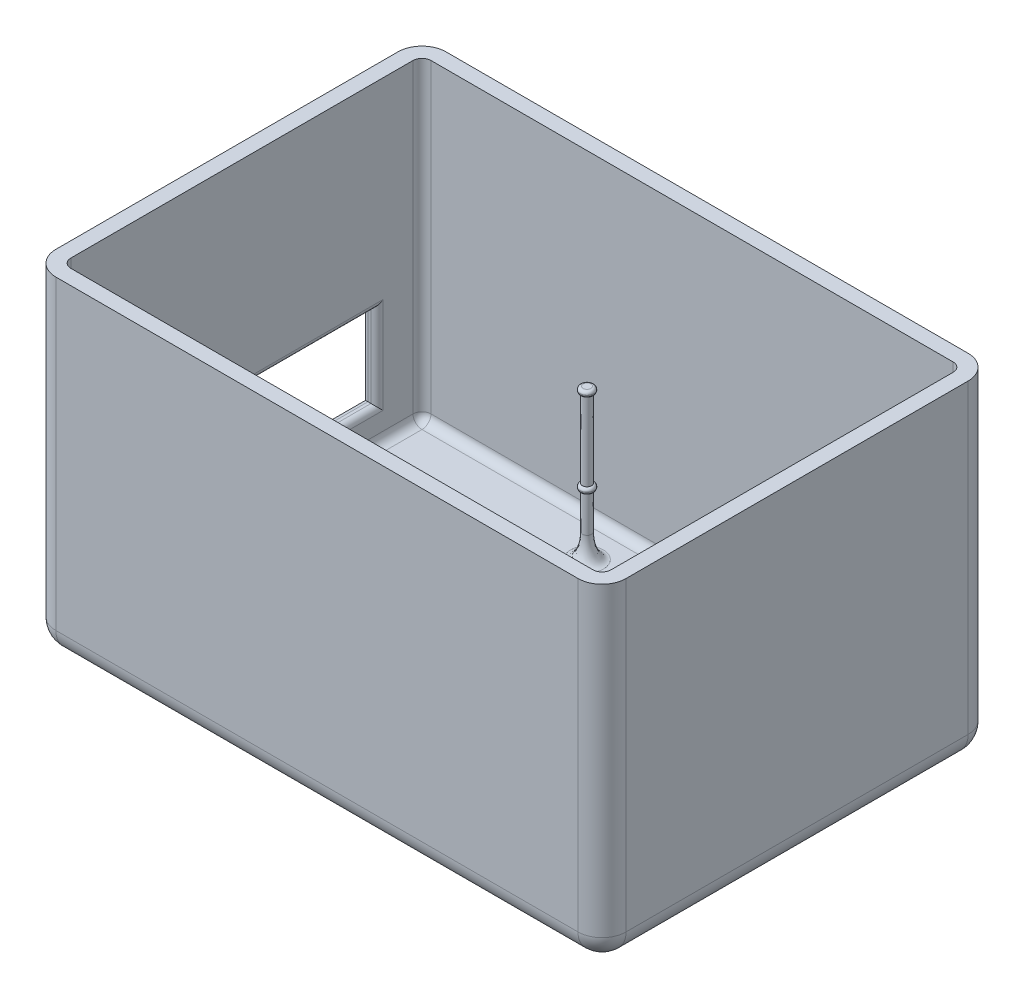
from build123d import *

# Parameters (mm, degrees)
SKETCH2_W           = 95
SKETCH2_H           = 65
BOSS_EXTRUDE1_DEPTH = 55
FILLET2_R           = 4
SHELL1_T            = -2.5
SKETCH10_R          = 0.75
BOSS_EXTRUDE2_DEPTH = 25
FILLET3_SIZE        = 2
FILLET3_SIZE_2      = 4
SKETCH12_R          = 1.15
BOSS_EXTRUDE3_DEPTH = 1
BOSS_EXTRUDE4_START = 1
SKETCH14_R          = 1.15
BOSS_EXTRUDE4_DEPTH = 1
FILLET4_R           = 0.5
SKETCH16_W          = 45
SKETCH16_H          = 14
CUT_EXTRUDE1_DEPTH  = 4
FILLET5_R           = 1


with BuildPart() as part:
    # Sketch2 → Boss-Extrude1 (new body)
    with BuildSketch(Plane(origin=(0, 0, 0), x_dir=(1, 0, 0), z_dir=(0, 1, 0))):
        with Locations((47.5, 32.5)):
            Rectangle(SKETCH2_W, SKETCH2_H)
    extrude(amount=BOSS_EXTRUDE1_DEPTH)

    # Fillet2
    fillet2_edges = [part.edges().sort_by_distance(p)[0] for p in [
        (47.5, 0, -65),
        (95, 0, -32.5),
        (47.5, 0, 0),
        (0, 0, -32.5),
        (0, 27.5, -65),
        (95, 27.5, -65),
        (95, 27.5, 0),
        (0, 27.5, 0),
    ]]
    fillet(fillet2_edges, radius=FILLET2_R)

    # Shell1
    shell1_openings = [part.faces().sort_by_distance(p)[0] for p in [
        (47.5, 55, -32.5),
    ]]
    offset(amount=SHELL1_T, openings=shell1_openings, kind=Kind.INTERSECTION)

    # Sketch10 → Boss-Extrude2 (add)
    with BuildSketch(Plane(origin=(0, 2.5, 0), x_dir=(1, 0, 0), z_dir=(0, 1, 0))):
        with Locations(Location((87.5, 12.5, 0), (0, 0, 90))):
            Circle(SKETCH10_R)
        with Locations(Location((87.5, 40.5, 0), (0, 0, 90))):
            Circle(SKETCH10_R)
        with Locations(Location((36.5, 56, 0), (0, 0, 90))):
            Circle(SKETCH10_R)
    extrude(amount=BOSS_EXTRUDE2_DEPTH)

    # Fillet3
    # an asymmetric fillet: 4, 2 mm, written as the material it adds along each edge
    with BuildSketch(Plane(origin=(87.5, 2.5, -12.5), x_dir=(0, 0, -1), z_dir=(1, 0, 0))) as fillet3_piece_1:
        with BuildLine():
            Bezier((0.75 + FILLET3_SIZE, 0), (0.75, 0), (0.75, FILLET3_SIZE_2), weights=[1, 0.707106781, 1])
            Line((0.75, FILLET3_SIZE_2), (0.75, 0))
            Line((0.75, 0), (0.75 + FILLET3_SIZE, 0))
        make_face()
    revolve(axis=Axis((87.5, 2.5, -12.5), (0, 1, 0)))
    with BuildSketch(Plane(origin=(87.5, 2.5, -40.5), x_dir=(0, 0, -1), z_dir=(1, 0, 0))) as fillet3_piece_2:
        with BuildLine():
            Bezier((0.75 + FILLET3_SIZE, 0), (0.75, 0), (0.75, FILLET3_SIZE_2), weights=[1, 0.707106781, 1])
            Line((0.75, FILLET3_SIZE_2), (0.75, 0))
            Line((0.75, 0), (0.75 + FILLET3_SIZE, 0))
        make_face()
    revolve(axis=Axis((87.5, 2.5, -40.5), (0, 1, 0)))
    with BuildSketch(Plane(origin=(36.5, 2.5, -56), x_dir=(0, 0, -1), z_dir=(1, 0, 0))) as fillet3_piece_3:
        with BuildLine():
            Bezier((0.75 + FILLET3_SIZE, 0), (0.75, 0), (0.75, FILLET3_SIZE_2), weights=[1, 0.707106781, 1])
            Line((0.75, FILLET3_SIZE_2), (0.75, 0))
            Line((0.75, 0), (0.75 + FILLET3_SIZE, 0))
        make_face()
    revolve(axis=Axis((36.5, 2.5, -56), (0, 1, 0)))

    # Sketch12 → Boss-Extrude3 (add)
    with BuildSketch(Plane(origin=(0, 12.5, 0), x_dir=(-1, 0, 0), z_dir=(0, -1, 0))):
        with Locations(Location((-36.5, 56, 0), (0, 0, 180))):
            Circle(SKETCH12_R)
        with Locations(Location((-87.5, 40.5, 0), (0, 0, 180))):
            Circle(SKETCH12_R)
        with Locations(Location((-87.5, 12.5, 0), (0, 0, 180))):
            Circle(SKETCH12_R)
    extrude(amount=-BOSS_EXTRUDE3_DEPTH)

    # Sketch14 → Boss-Extrude4 (add)
    with BuildSketch(Plane(origin=(0, 27.5, 0), x_dir=(-1, 0, 0), z_dir=(0, -1, 0)).offset(BOSS_EXTRUDE4_START)):
        with Locations(Location((-36.5, 56, 0), (0, 0, 180))):
            Circle(SKETCH14_R)
        with Locations(Location((-87.5, 40.5, 0), (0, 0, 180))):
            Circle(SKETCH14_R)
        with Locations(Location((-87.5, 12.5, 0), (0, 0, 180))):
            Circle(SKETCH14_R)
    extrude(amount=-BOSS_EXTRUDE4_DEPTH)

    # Fillet4
    # the kernel refuses this fillet: 0.5 mm, written as the material it takes off along each edge
    with BuildSketch(Plane(origin=(36.5, 13.5, -56), x_dir=(1, 0, 0), z_dir=(0, 0, -1))) as fillet4_piece_1:
        with BuildLine():
            CenterArc((0.65, 0.489897949), FILLET4_R, 281.536959033, 78.463040967)
            Line((0.75, 0), (0.752, -0.009797959))
            ThreePointArc((0.752, -0.009797959), (0.95, -0.01), (1.15, -0.01))
            Line((1.15, -0.01), (1.16, 0))
            Line((1.16, 0), (1.16, 0.489897949))
            Line((1.16, 0.489897949), (1.15, 0.489897949))
        make_face()
    revolve(axis=Axis((36.5, 13.5, -56), (0, -1, 0)), mode=Mode.SUBTRACT)
    with BuildSketch(Plane(origin=(36.5, 12.5, -56), x_dir=(1, 0, 0), z_dir=(0, 0, -1))) as fillet4_piece_2:
        with BuildLine():
            CenterArc((0.65, -0.489897949), FILLET4_R, 360, 78.463040967)
            Line((1.15, -0.489897949), (1.16, -0.489897949))
            Line((1.16, -0.489897949), (1.16, 0))
            Line((1.16, 0), (1.15, 0.01))
            ThreePointArc((1.15, 0.01), (0.95, 0.01), (0.752, 0.009797959))
            Line((0.752, 0.009797959), (0.75, 0))
        make_face()
    revolve(axis=Axis((36.5, 12.5, -56), (0, -1, 0)), mode=Mode.SUBTRACT)
    with BuildSketch(Plane(origin=(87.5, 13.5, -40.5), x_dir=(1, 0, 0), z_dir=(0, 0, -1))) as fillet4_piece_3:
        with BuildLine():
            CenterArc((0.65, 0.489897949), FILLET4_R, 281.536959033, 78.463040967)
            Line((0.75, 0), (0.752, -0.009797959))
            ThreePointArc((0.752, -0.009797959), (0.95, -0.01), (1.15, -0.01))
            Line((1.15, -0.01), (1.16, 0))
            Line((1.16, 0), (1.16, 0.489897949))
            Line((1.16, 0.489897949), (1.15, 0.489897949))
        make_face()
    revolve(axis=Axis((87.5, 13.5, -40.5), (0, -1, 0)), mode=Mode.SUBTRACT)
    with BuildSketch(Plane(origin=(87.5, 12.5, -40.5), x_dir=(1, 0, 0), z_dir=(0, 0, -1))) as fillet4_piece_4:
        with BuildLine():
            CenterArc((0.65, -0.489897949), FILLET4_R, 0, 78.463040967)
            Line((1.15, -0.489897949), (1.16, -0.489897949))
            Line((1.16, -0.489897949), (1.16, 0))
            Line((1.16, 0), (1.15, 0.01))
            ThreePointArc((1.15, 0.01), (0.95, 0.01), (0.752, 0.009797959))
            Line((0.752, 0.009797959), (0.75, 0))
        make_face()
    revolve(axis=Axis((87.5, 12.5, -40.5), (0, -1, 0)), mode=Mode.SUBTRACT)
    with BuildSketch(Plane(origin=(87.5, 13.5, -12.5), x_dir=(1, 0, 0), z_dir=(0, 0, -1))) as fillet4_piece_5:
        with BuildLine():
            CenterArc((0.65, 0.489897949), FILLET4_R, 281.536959033, 78.463040967)
            Line((0.75, 0), (0.752, -0.009797959))
            ThreePointArc((0.752, -0.009797959), (0.95, -0.01), (1.15, -0.01))
            Line((1.15, -0.01), (1.16, 0))
            Line((1.16, 0), (1.16, 0.489897949))
            Line((1.16, 0.489897949), (1.15, 0.489897949))
        make_face()
    revolve(axis=Axis((87.5, 13.5, -12.5), (0, -1, 0)), mode=Mode.SUBTRACT)
    with BuildSketch(Plane(origin=(87.5, 12.5, -12.5), x_dir=(1, 0, 0), z_dir=(0, 0, -1))) as fillet4_piece_6:
        with BuildLine():
            CenterArc((0.65, -0.489897949), FILLET4_R, 0, 78.463040967)
            Line((1.15, -0.489897949), (1.16, -0.489897949))
            Line((1.16, -0.489897949), (1.16, 0))
            Line((1.16, 0), (1.15, 0.01))
            ThreePointArc((1.15, 0.01), (0.95, 0.01), (0.752, 0.009797959))
            Line((0.752, 0.009797959), (0.75, 0))
        make_face()
    revolve(axis=Axis((87.5, 12.5, -12.5), (0, -1, 0)), mode=Mode.SUBTRACT)
    with BuildSketch(Plane(origin=(36.5, 27.5, -56), x_dir=(1, 0, 0), z_dir=(0, 0, -1))) as fillet4_piece_7:
        with BuildLine():
            CenterArc((1.15 - FILLET4_R, FILLET4_R), FILLET4_R, 270, 90)
            Line((1.15 - FILLET4_R, 0), (1.15 - FILLET4_R, -FILLET4_R * 0.02))
            Line((1.15 - FILLET4_R, -FILLET4_R * 0.02), (1.15 + FILLET4_R * 0.02, -FILLET4_R * 0.02))
            Line((1.15 + FILLET4_R * 0.02, -FILLET4_R * 0.02), (1.15 + FILLET4_R * 0.02, FILLET4_R))
            Line((1.15 + FILLET4_R * 0.02, FILLET4_R), (1.15, FILLET4_R))
        make_face()
    revolve(axis=Axis((36.5, 27.5, -56), (0, -1, 0)), mode=Mode.SUBTRACT)
    with BuildSketch(Plane(origin=(36.5, 26.5, -56), x_dir=(1, 0, 0), z_dir=(0, 0, -1))) as fillet4_piece_8:
        with BuildLine():
            CenterArc((0.65, -0.489897949), FILLET4_R, 0, 78.463040967)
            Line((1.15, -0.489897949), (1.16, -0.489897949))
            Line((1.16, -0.489897949), (1.16, 0))
            Line((1.16, 0), (1.15, 0.01))
            ThreePointArc((1.15, 0.01), (0.95, 0.01), (0.752, 0.009797959))
            Line((0.752, 0.009797959), (0.75, 0))
        make_face()
    revolve(axis=Axis((36.5, 26.5, -56), (0, -1, 0)), mode=Mode.SUBTRACT)
    with BuildSketch(Plane(origin=(87.5, 27.5, -40.5), x_dir=(1, 0, 0), z_dir=(0, 0, -1))) as fillet4_piece_9:
        with BuildLine():
            CenterArc((1.15 - FILLET4_R, FILLET4_R), FILLET4_R, 270, 90)
            Line((1.15 - FILLET4_R, 0), (1.15 - FILLET4_R, -FILLET4_R * 0.02))
            Line((1.15 - FILLET4_R, -FILLET4_R * 0.02), (1.15 + FILLET4_R * 0.02, -FILLET4_R * 0.02))
            Line((1.15 + FILLET4_R * 0.02, -FILLET4_R * 0.02), (1.15 + FILLET4_R * 0.02, FILLET4_R))
            Line((1.15 + FILLET4_R * 0.02, FILLET4_R), (1.15, FILLET4_R))
        make_face()
    revolve(axis=Axis((87.5, 27.5, -40.5), (0, -1, 0)), mode=Mode.SUBTRACT)
    with BuildSketch(Plane(origin=(87.5, 26.5, -40.5), x_dir=(1, 0, 0), z_dir=(0, 0, -1))) as fillet4_piece_10:
        with BuildLine():
            CenterArc((0.65, -0.489897949), FILLET4_R, 0, 78.463040967)
            Line((1.15, -0.489897949), (1.16, -0.489897949))
            Line((1.16, -0.489897949), (1.16, 0))
            Line((1.16, 0), (1.15, 0.01))
            ThreePointArc((1.15, 0.01), (0.95, 0.01), (0.752, 0.009797959))
            Line((0.752, 0.009797959), (0.75, 0))
        make_face()
    revolve(axis=Axis((87.5, 26.5, -40.5), (0, -1, 0)), mode=Mode.SUBTRACT)
    with BuildSketch(Plane(origin=(87.5, 27.5, -12.5), x_dir=(1, 0, 0), z_dir=(0, 0, -1))) as fillet4_piece_11:
        with BuildLine():
            CenterArc((1.15 - FILLET4_R, FILLET4_R), FILLET4_R, 270, 90)
            Line((1.15 - FILLET4_R, 0), (1.15 - FILLET4_R, -FILLET4_R * 0.02))
            Line((1.15 - FILLET4_R, -FILLET4_R * 0.02), (1.15 + FILLET4_R * 0.02, -FILLET4_R * 0.02))
            Line((1.15 + FILLET4_R * 0.02, -FILLET4_R * 0.02), (1.15 + FILLET4_R * 0.02, FILLET4_R))
            Line((1.15 + FILLET4_R * 0.02, FILLET4_R), (1.15, FILLET4_R))
        make_face()
    revolve(axis=Axis((87.5, 27.5, -12.5), (0, -1, 0)), mode=Mode.SUBTRACT)
    with BuildSketch(Plane(origin=(87.5, 26.5, -12.5), x_dir=(1, 0, 0), z_dir=(0, 0, -1))) as fillet4_piece_12:
        with BuildLine():
            CenterArc((0.65, -0.489897949), FILLET4_R, 0, 78.463040967)
            Line((1.15, -0.489897949), (1.16, -0.489897949))
            Line((1.16, -0.489897949), (1.16, 0))
            Line((1.16, 0), (1.15, 0.01))
            ThreePointArc((1.15, 0.01), (0.95, 0.01), (0.752, 0.009797959))
            Line((0.752, 0.009797959), (0.75, 0))
        make_face()
    revolve(axis=Axis((87.5, 26.5, -12.5), (0, -1, 0)), mode=Mode.SUBTRACT)

    # Sketch16 → Cut-Extrude1 (cut)
    with BuildSketch(Plane.ZY):
        with Locations((-32.5, 15)):
            Rectangle(SKETCH16_W, SKETCH16_H)
    extrude(amount=-CUT_EXTRUDE1_DEPTH, mode=Mode.SUBTRACT)

    # Fillet5
    fillet5_edges = [part.edges().sort_by_distance(p)[0] for p in [
        (2.5, 8, -32.5),
        (2.5, 15, -10),
        (2.5, 22, -32.5),
        (2.5, 15, -55),
        (0, 15, -55),
        (0, 8, -32.5),
        (0, 15, -10),
        (0, 22, -32.5),
    ]]
    fillet(fillet5_edges, radius=FILLET5_R)


solid = part.part
